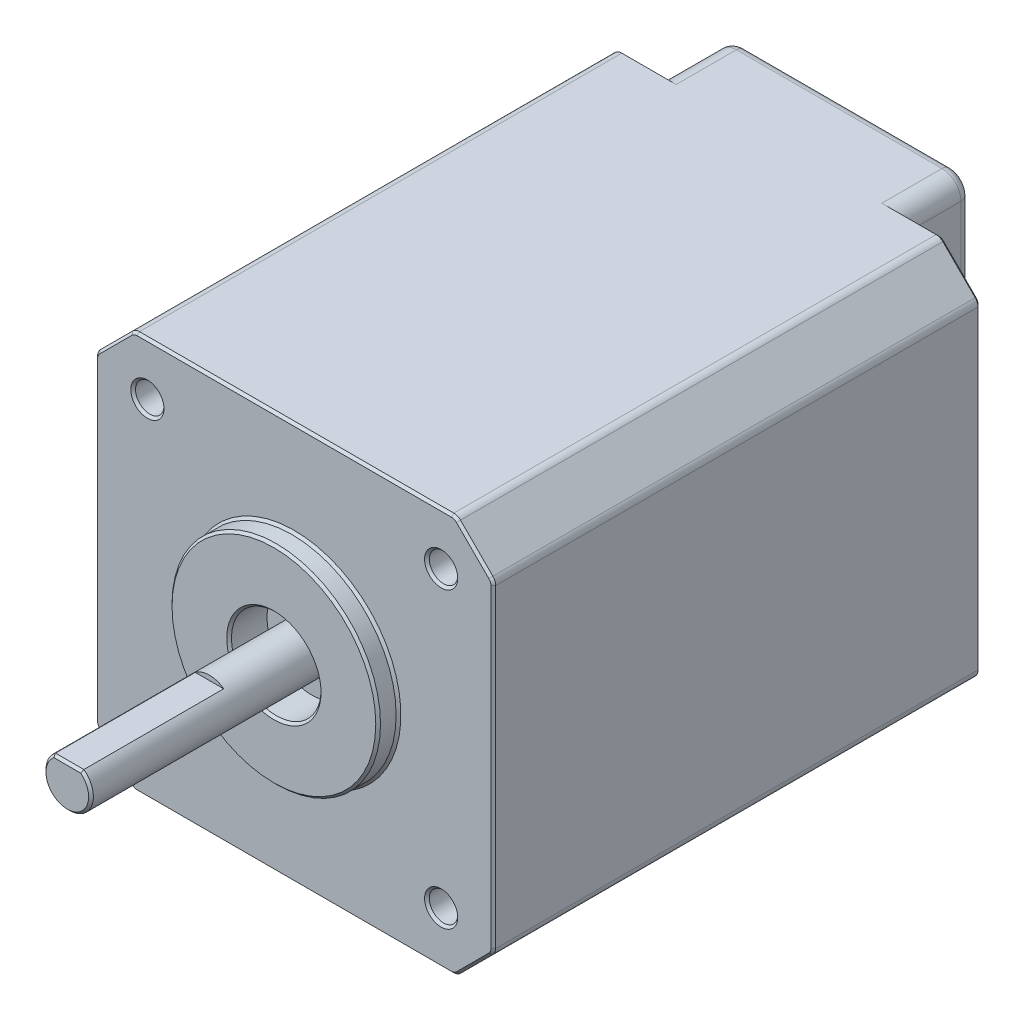
from build123d import *

# Parameters (mm, degrees)
BOSS_EXTRUDE1_DEPTH = 51.4
SKETCH2_R           = 1.5
CUT_EXTRUDE1_DEPTH  = 4.5
SKETCH3_R           = 11
BOSS_EXTRUDE2_DEPTH = 2.15
SKETCH5_R           = 4.725
CUT_EXTRUDE2_DEPTH  = 4
SKETCH4_R           = 2.5
BOSS_EXTRUDE3_DEPTH = 25.8
CUT_EXTRUDE3_START  = -15
CUT_EXTRUDE3_DEPTH  = 15
SKETCH7_W           = 25.7
SKETCH7_H           = 13.9
BOSS_EXTRUDE4_DEPTH = 7.1
FILLET1_R           = 1
FILLET2_R           = 2
CHAMFER1_SIZE       = 0.25


with BuildPart() as part:
    # Sketch1 → Boss-Extrude1 (new body)
    with BuildSketch(Plane.XY):
        Polygon((-21, 17), (-17, 21), (17, 21), (21, 17), (21, -17), (17, -21), (-17, -21), (-21, -17), align=None)
    extrude(amount=-BOSS_EXTRUDE1_DEPTH)

    # Sketch2 → Cut-Extrude1 (cut)
    with BuildSketch(Plane.XY):
        with Locations((-15.5, 15.5)):
            Circle(SKETCH2_R)
        with Locations(Location((15.5, 15.5, 0), (0, 0, 180))):
            Circle(SKETCH2_R)
        with Locations((15.5, -15.5)):
            Circle(SKETCH2_R)
        with Locations(Location((-15.5, -15.5, 0), (0, 0, 180))):
            Circle(SKETCH2_R)
    extrude(amount=-CUT_EXTRUDE1_DEPTH, mode=Mode.SUBTRACT)

    # Sketch3 → Boss-Extrude2 (add)
    with BuildSketch(Plane.XY):
        with Locations(Location((0, 0, 0), (0, 0, 180))):
            Circle(SKETCH3_R)
    extrude(amount=BOSS_EXTRUDE2_DEPTH)

    # Sketch5 → Cut-Extrude2 (cut)
    with BuildSketch(Plane.XY.offset(2.15)):
        Circle(SKETCH5_R)
    extrude(amount=-CUT_EXTRUDE2_DEPTH, mode=Mode.SUBTRACT)

    # Sketch4 → Boss-Extrude3 (add)
    with BuildSketch(Plane.XY.offset(-1.85)):
        Circle(SKETCH4_R)
    extrude(amount=BOSS_EXTRUDE3_DEPTH)

    # Sketch6 → Cut-Extrude3 (cut)
    with BuildSketch(Plane.XY.offset(23.95).offset(CUT_EXTRUDE3_START)):
        with BuildLine():
            Line((-1.5, 2), (1.5, 2))
            ThreePointArc((1.5, 2), (0, 2.5), (-1.5, 2))
        make_face()
    extrude(amount=CUT_EXTRUDE3_DEPTH, mode=Mode.SUBTRACT)

    # Sketch7 → Boss-Extrude4 (add)
    with BuildSketch(Plane(origin=(0, 0, -51.4), x_dir=(-1, 0, 0), z_dir=(0, 0, -1))):
        with Locations((0, 14.05)):
            Rectangle(SKETCH7_W, SKETCH7_H)
    extrude(amount=BOSS_EXTRUDE4_DEPTH)

    # Fillet1
    fillet1_edges = [part.edges().sort_by_distance(p)[0] for p in [
        (17, 21, -25.7),
        (21, 17, -25.7),
        (21, -17, -25.7),
        (17, -21, -25.7),
        (-17, -21, -25.7),
        (-21, -17, -25.7),
        (-21, 17, -25.7),
        (-17, 21, -25.7),
        (0, 7.1, -58.5),
        (-12.85, 14.05, -58.5),
        (0, 21, -58.5),
        (12.85, 14.05, -58.5),
    ]]
    fillet(fillet1_edges, radius=FILLET1_R)

    # Fillet2
    # the kernel refuses this fillet: 2 mm, written as the material it takes off along each edge
    with BuildSketch(Plane(origin=(-10.85, 19, -58.5), x_dir=(-1, 0, 0), z_dir=(0, -1, 0))) as fillet2_piece_1:
        with BuildLine():
            CenterArc((1, -1), 1, 0, 90)
            Line((2, -1), (2, 0))
            Line((2, 0), (1, 0))
        make_face()
    revolve(axis=Axis((-10.85, 19, -58.5), (0, 0, -1)), revolution_arc=90, mode=Mode.SUBTRACT)
    with BuildSketch(Plane(origin=(-10.85, 9.1, -58.5), x_dir=(0, -1, 0), z_dir=(1, 0, 0))) as fillet2_piece_2:
        with BuildLine():
            CenterArc((1, -1), 1, 0, 90)
            Line((2, -1), (2, 0))
            Line((2, 0), (1, 0))
        make_face()
    revolve(axis=Axis((-10.85, 9.1, -58.5), (0, 0, -1)), revolution_arc=90, mode=Mode.SUBTRACT)
    with BuildSketch(Plane(origin=(10.85, 19, -58.5), x_dir=(0, 1, 0), z_dir=(-1, 0, 0))) as fillet2_piece_3:
        with BuildLine():
            CenterArc((1, -1), 1, 0, 90)
            Line((2, -1), (2, 0))
            Line((2, 0), (1, 0))
        make_face()
    revolve(axis=Axis((10.85, 19, -58.5), (0, 0, -1)), revolution_arc=90, mode=Mode.SUBTRACT)
    with BuildSketch(Plane(origin=(10.85, 9.1, -58.5), x_dir=(1, 0, 0), z_dir=(0, 1, 0))) as fillet2_piece_4:
        with BuildLine():
            CenterArc((1, -1), 1, 0, 90)
            Line((2, -1), (2, 0))
            Line((2, 0), (1, 0))
        make_face()
    revolve(axis=Axis((10.85, 9.1, -58.5), (0, 0, -1)), revolution_arc=90, mode=Mode.SUBTRACT)
    with BuildSketch(Plane(origin=(12.85, 21, -51.4), x_dir=(-1, 0, 0), z_dir=(0, 0, -1))) as fillet2_piece_5:
        with BuildLine():
            CenterArc((FILLET2_R, -FILLET2_R), FILLET2_R, 90, 90)
            Line((0, -FILLET2_R), (0, 0))
            Line((0, 0), (FILLET2_R, 0))
        make_face()
    extrude(amount=7.1, mode=Mode.SUBTRACT)
    with BuildSketch(Plane(origin=(12.85, 7.1, -51.4), x_dir=(-1, 0, 0), z_dir=(0, 0, -1)), Plane(origin=(-12.85, 21, -51.4), x_dir=(1, 0, 0), z_dir=(0, 0, -1)), Plane(origin=(-12.85, 7.1, -51.4), x_dir=(0, 1, 0), z_dir=(0, 0, -1))) as fillet2_piece_6:
        with BuildLine():
            CenterArc((FILLET2_R, FILLET2_R), FILLET2_R, 180, 90)
            Line((0, FILLET2_R), (0, 0))
            Line((0, 0), (FILLET2_R, 0))
        make_face()
    extrude(amount=7.1, mode=Mode.SUBTRACT)

    # Chamfer1
    chamfer1_edges = [part.edges().sort_by_distance(p)[0] for p in [
        (16.96846987, 20.923879533, 0),
        (21, 0, -51.4),
        (19, -19, -51.4),
        (0, -21, -51.4),
        (-19, -19, -51.4),
        (-21, 0, -51.4),
        (-19, 19, -51.4),
        (-20.923879533, 16.96846987, -51.4),
        (-16.96846987, 20.923879533, -51.4),
        (-20.923879533, -16.96846987, -51.4),
        (-16.96846987, -20.923879533, -51.4),
        (16.96846987, -20.923879533, -51.4),
        (20.923879533, -16.96846987, -51.4),
        (20.923879533, 16.96846987, -51.4),
        (16.96846987, 20.923879533, -51.4),
        (-14, -15.5, 0),
        (14, -15.5, 0),
        (17, 15.5, 0),
        (-17, 15.5, 0),
        (11, 0, 0),
        (11, 0, 2.15),
        (-4.725, 0, 2.15),
        (-1.118033989, -2.236067977, 23.95),
        (0, 2, 23.95),
        (-13.717893219, 21, -51.4),
        (0, 21, 0),
        (13.717893219, 21, -51.4),
        (19, 19, 0),
        (19, 19, -51.4),
        (-19, 19, 0),
        (-21, 0, 0),
        (-19, -19, 0),
        (0, -21, 0),
        (19, -19, 0),
        (21, 0, 0),
        (-20.923879533, 16.96846987, 0),
        (-16.96846987, 20.923879533, 0),
        (-20.923879533, -16.96846987, 0),
        (-16.96846987, -20.923879533, 0),
        (16.96846987, -20.923879533, 0),
        (20.923879533, -16.96846987, 0),
        (20.923879533, 16.96846987, 0),
    ]]
    chamfer(chamfer1_edges, length=CHAMFER1_SIZE)


solid = part.part
